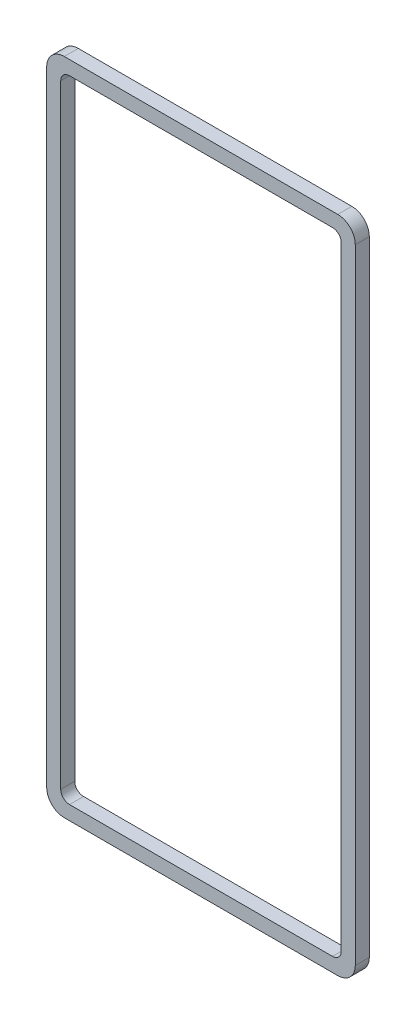
from build123d import *

# Parameters (mm, degrees)
ESQUISSE1_W        = 880
ESQUISSE1_H        = 1880
ESQUISSE1_W_2      = 800
ESQUISSE1_H_2      = 1800
BOSS_EXTRU_1_DEPTH = 40
CONG_1_R           = 50
CONG_2_R           = 25


with BuildPart() as part:
    # Esquisse1 → Boss.-Extru.1 (new body)
    with BuildSketch(Plane.XY):
        with Locations((440, 940)):
            Rectangle(ESQUISSE1_W, ESQUISSE1_H)
        with Locations((440, 940)):
            Rectangle(ESQUISSE1_W_2, ESQUISSE1_H_2, mode=Mode.SUBTRACT)
    extrude(amount=BOSS_EXTRU_1_DEPTH)

    # Congé1
    cong_1_edges = [part.edges().sort_by_distance(p)[0] for p in [
        (0, 0, 20),
        (880, 0, 20),
        (880, 1880, 20),
        (0, 1880, 20),
    ]]
    fillet(cong_1_edges, radius=CONG_1_R)

    # Congé2
    cong_2_edges = [part.edges().sort_by_distance(p)[0] for p in [
        (40, 1840, 20),
        (40, 40, 20),
        (840, 40, 20),
        (840, 1840, 20),
    ]]
    fillet(cong_2_edges, radius=CONG_2_R)


solid = part.part
